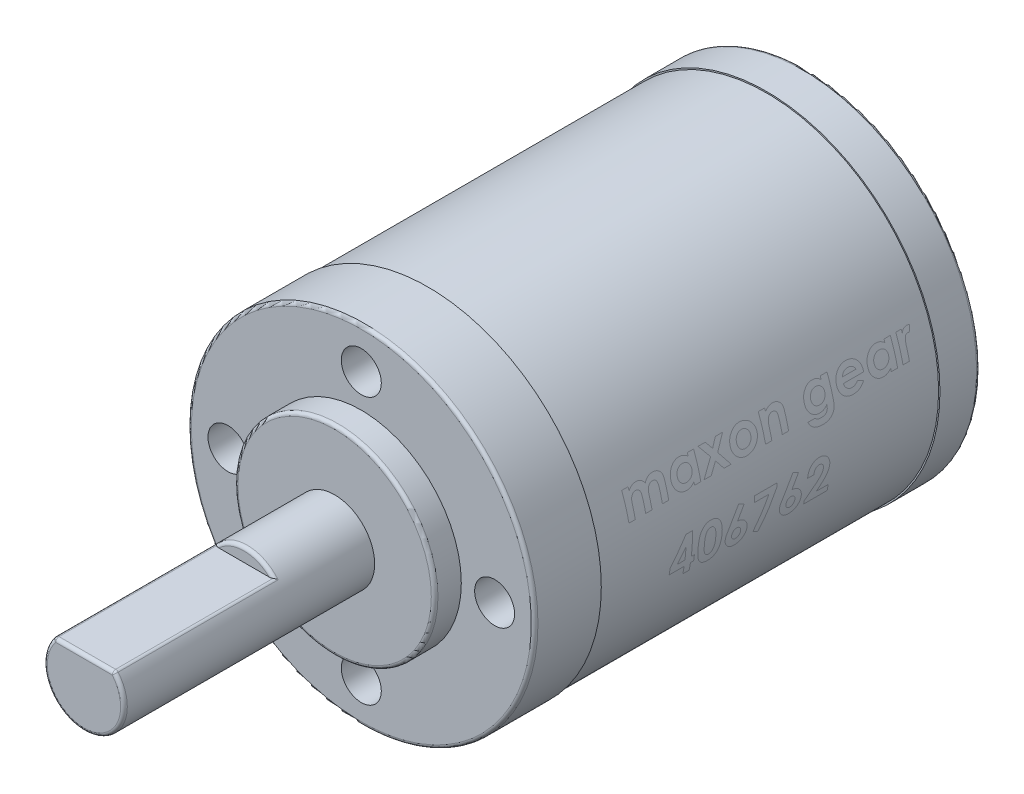
from build123d import *

# Parameters (mm, degrees)
ESQUISSE2_R             = 1.5
ENL_V_MAT_EXTRU_1_DEPTH = 5
ENL_V_START             = -12
ENL_V_MAT_EXTRU_2_DEPTH = 12
CONG_1_R                = 0.25


with BuildPart() as part:
    # Esquisse1 → Révolution1 (revolve)
    with BuildSketch(Plane(origin=(0, 0, 0), x_dir=(0, 0, -1), z_dir=(1, 0, 0))):
        Polygon((18.8, 3), (18.8, 7.5), (20.8, 7.5), (20.8, 13), (25.8, 13), (25.8, 12.9), (51.2, 12.9), (51.2, 13), (54.2, 13), (54.2, 0), (0, 0), (0, 3), align=None)
    revolve(axis=Axis((0, 0, 0), (0, 0, -1)))

    # Esquisse2 → Enlèv. mat.-Extru.1 (cut)
    with BuildSketch(Plane.XY.offset(-20.8)):
        with Locations((0, 10)):
            Circle(ESQUISSE2_R)
        with Locations((10, 0)):
            Circle(ESQUISSE2_R)
        with Locations((0, -10)):
            Circle(ESQUISSE2_R)
        with Locations((-10, 0)):
            Circle(ESQUISSE2_R)
    extrude(amount=-ENL_V_MAT_EXTRU_1_DEPTH, mode=Mode.SUBTRACT)

    # Esquisse3 → Enlèv. mat.-Extru.2 (cut)
    with BuildSketch(Plane.XY.offset(ENL_V_START)):
        with BuildLine():
            Line((-2.236067977, 2), (2.236067977, 2))
            ThreePointArc((2.236067977, 2), (0, 3), (-2.236067977, 2))
        make_face()
    extrude(amount=ENL_V_MAT_EXTRU_2_DEPTH, mode=Mode.SUBTRACT)

    # Congé1
    cong_1_edges = [part.edges().sort_by_distance(p)[0] for p in [
        (0, -13, -54.2),
        (-1.224744871, 2.738612788, -12),
        (-2.236067977, 2, -6),
        (2.236067977, 2, -6),
        (0, -13, -20.8),
        (0, -7.5, -18.8),
        (0, -3, 0),
        (0, 2, 0),
    ]]
    fillet(cong_1_edges, radius=CONG_1_R)


solid = part.part
